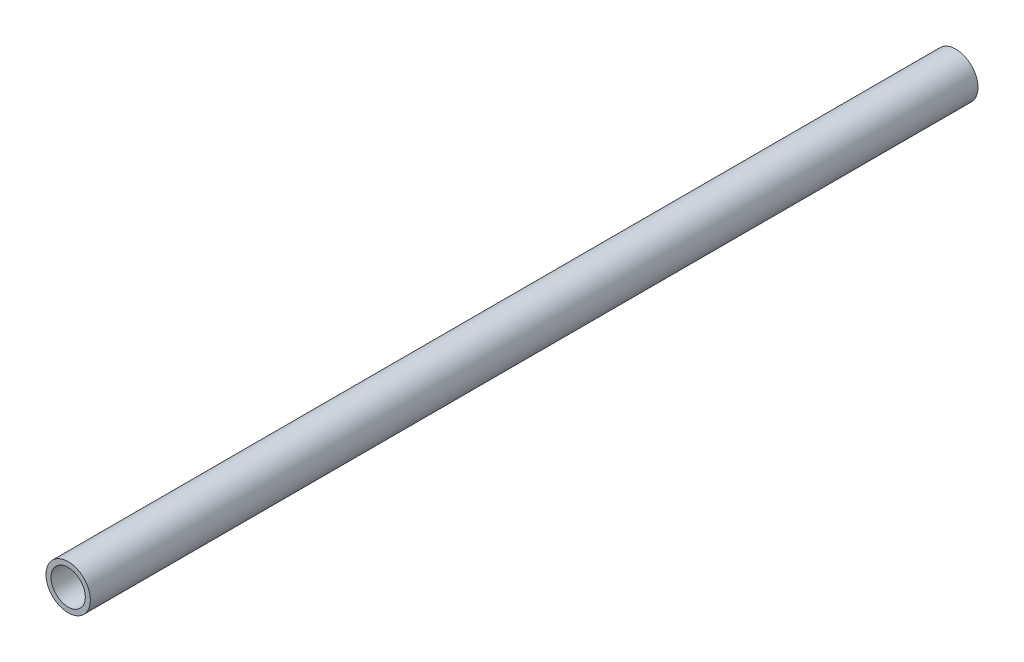
from build123d import *

# Parameters (mm, degrees)
SKETCH2_R           = 4.7625
SKETCH2_R_2         = 3.683
BOSS_EXTRUDE1_DEPTH = 95.25


with BuildPart() as part:
    # Sketch2 → Boss-Extrude1 (new, symmetric)
    with BuildSketch(Plane.XY):
        Circle(SKETCH2_R)
        Circle(SKETCH2_R_2, mode=Mode.SUBTRACT)
    extrude(amount=BOSS_EXTRUDE1_DEPTH, both=True)


solid = part.part
